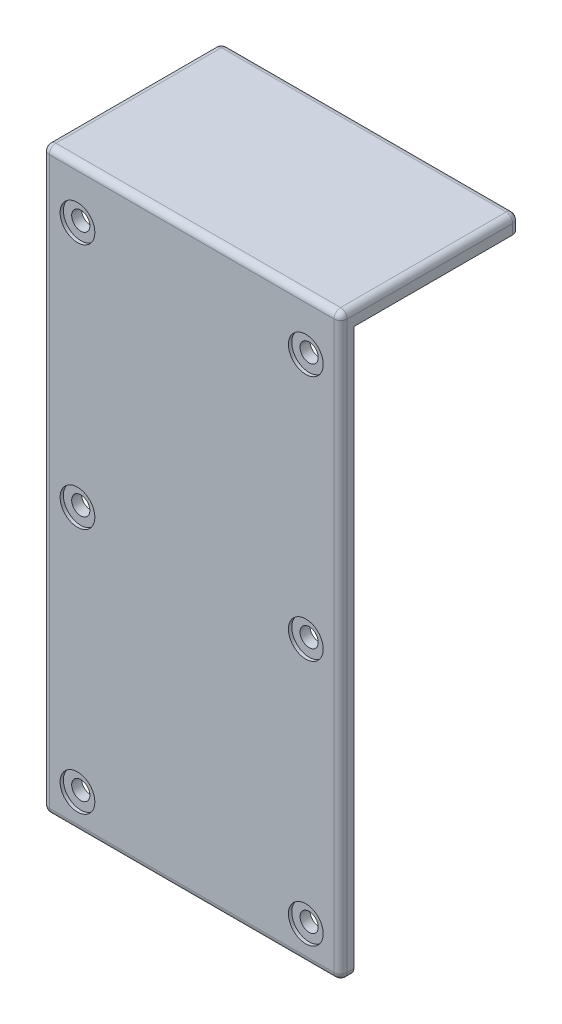
from build123d import *

# Parameters (mm, degrees)
SKETCH1_W                       = 90
SKETCH1_H                       = 170
BOSS_EXTRUDE1_DEPTH             = 4
CBORE_FOR_M5_SBHCS1_D           = 5.5
CBORE_FOR_M5_SBHCS1_CBORE_D     = 10.5
CBORE_FOR_M5_SBHCS1_CBORE_DEPTH = 1
SKETCH4_W                       = 90
SKETCH4_H                       = 54
BOSS_EXTRUDE2_DEPTH             = 5
FILLET1_R                       = 2


with BuildPart() as part:
    # Sketch1 → Boss-Extrude1 (new body)
    with BuildSketch(Plane.XY):
        with Locations((45, 85)):
            Rectangle(SKETCH1_W, SKETCH1_H)
    extrude(amount=BOSS_EXTRUDE1_DEPTH)

    # CBORE for M5 SBHCS1 (through all)
    with Locations(Plane.XY.offset(4)):
        with Locations((79.5, 159.5), (10.5, 85), (10.5, 159.5), (79.5, 85), (10.5, 10.5), (79.5, 10.5)):
            CounterBoreHole(CBORE_FOR_M5_SBHCS1_D / 2, CBORE_FOR_M5_SBHCS1_CBORE_D / 2, CBORE_FOR_M5_SBHCS1_CBORE_DEPTH)

    # Sketch4 → Boss-Extrude2 (add)
    with BuildSketch(Plane(origin=(0, 170, 0), x_dir=(1, 0, 0), z_dir=(0, 1, 0))):
        with Locations((45, 23)):
            Rectangle(SKETCH4_W, SKETCH4_H)
    extrude(amount=BOSS_EXTRUDE2_DEPTH)

    # Fillet1
    fillet1_edges = [part.edges().sort_by_distance(p)[0] for p in [
        (0, 172.5, -50),
        (90, 172.5, -50),
        (45, 175, -50),
        (90, 0, 2),
        (0, 0, 2),
        (45, 0, 4),
        (0, 87.5, 4),
        (0, 175, -23),
        (90, 175, -23),
        (90, 87.5, 4),
        (45, 175, 4),
    ]]
    fillet(fillet1_edges, radius=FILLET1_R)


solid = part.part
